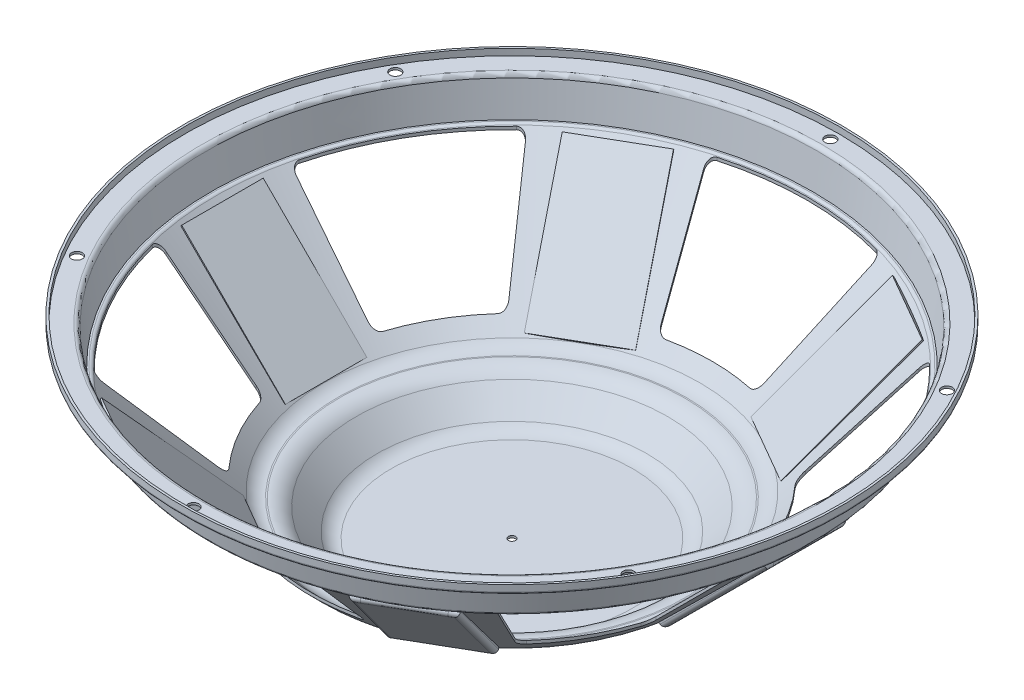
from build123d import *

# Parameters (mm, degrees)
CUT_EXTRUDE_START                  = -5
CUT_EXTRUDE_2_DEPTH                = 113
PATTERN_CIRCULAR_2_COUNT           = 6
SKETCH_9_W                         = 67.51792832
SKETCH_9_H                         = 37.576660832
EXTRUDE_1_DEPTH                    = 4
FILLET_22_R                        = 2
PATTERN_CIRCULAR_33_COUNT          = 6
FILLET_22_OF_PATTERN_CIRCULAR_33_R = 2
SKETCH_13_R                        = 2.5
CUT_EXTRUDE_3_DEPTH                = 234.040768965


with BuildPart() as part:
    # Эскиз1 → Повернуть-Тонкостенный6 (revolve)
    with BuildSketch(Plane.XY, mode=Mode.PRIVATE) as revolve_6_sk:
        with BuildLine():
            Line((1.654421967, 0), (55.740283985, 0))
            ThreePointArc((55.740283985, 0), (59.659260325, 0.799911716), (62.951269649, 3.071675112))
            Line((62.951269649, 3.071675112), (72.561011195, 13.073473474))
            ThreePointArc((72.561011195, 13.073473474), (75.853020518, 15.34523687), (79.771996859, 16.145148586))
            Line((79.771996859, 16.145148586), (80.37014522, 16.145148586))
            ThreePointArc((80.37014522, 16.145148586), (84.196979544, 16.906353261), (87.441213032, 19.074080774))
            Line((87.441213032, 19.074080774), (137.252396214, 68.885263956))
            ThreePointArc((137.252396214, 68.885263956), (137.576819563, 69.102036707), (137.959502995, 69.178157175))
            Line((137.959502995, 69.178157175), (138.680622607, 69.178157175))
            ThreePointArc((138.680622607, 69.178157175), (139.334688835, 69.421719888), (139.670142773, 70.033762436))
            Line((139.670142773, 70.033762436), (141.875146659, 85.144394739))
            ThreePointArc((141.875146659, 85.144394739), (142.210600598, 85.756437287), (142.864666825, 86))
            Line((142.864666825, 86), (151, 86))
            ThreePointArc((151, 86), (151.707106781, 86.292893219), (152, 87))
            Line((152, 87), (152, 90))
            Line((152, 90), (151, 90))
            Line((151, 90), (151, 87))
            Line((151, 87), (142.864666825, 87))
            ThreePointArc((142.864666825, 87), (141.55653437, 86.512874575), (140.885626493, 85.288789479))
            Line((140.885626493, 85.288789479), (138.680622607, 70.178157175))
            Line((138.680622607, 70.178157175), (137.959502995, 70.178157175))
            ThreePointArc((137.959502995, 70.178157175), (137.19413613, 70.02591624), (136.545289433, 69.592370737))
            Line((136.545289433, 69.592370737), (86.734106251, 19.781187555))
            ThreePointArc((86.734106251, 19.781187555), (83.814296111, 17.830232793), (80.37014522, 17.145148586))
            Line((80.37014522, 17.145148586), (79.771996859, 17.145148586))
            ThreePointArc((79.771996859, 17.145148586), (75.461122884, 16.265245699), (71.839912629, 13.766305963))
            Line((71.839912629, 13.766305963), (62.230171082, 3.7645076))
            ThreePointArc((62.230171082, 3.7645076), (59.267362691, 1.719920544), (55.740283985, 1))
            Line((55.740283985, 1), (1.654421967, 1))
            Line((1.654421967, 1), (1.654421967, 0))
        make_face()
    revolve(revolve_6_sk.sketch.rotate(Axis((0, 0, 0), (0, 1, 0)), 90), axis=Axis((0, 0, 0), (0, 1, 0)))

    # Эскиз4 → Вырез-Вытянуть2 (cut)
    with BuildSketch(Plane(origin=(0, 0, 0), x_dir=(1, 0, 0), z_dir=(0, 1, 0)).offset(CUT_EXTRUDE_START)):
        with BuildLine():
            Line((-38.658178622, -127.136601906), (-23.822761983, -92.729045494))
            ThreePointArc((-23.822761983, -92.729045494), (-21.984740883, -90.758563544), (-19.313915643, -90.401053807))
            ThreePointArc((-19.313915643, -90.401053807), (-9.710684671, -91.929758349), (0, -92.441213032))
            ThreePointArc((0, -92.441213032), (9.710684671, -91.929758349), (19.313915643, -90.401053807))
            ThreePointArc((19.313915643, -90.401053807), (21.984740883, -90.758563544), (23.822761983, -92.729045494))
            Line((23.822761983, -92.729045494), (38.658178622, -127.136601906))
            ThreePointArc((38.658178622, -127.136601906), (38.610587871, -129.616995409), (36.711655291, -131.213451444))
            ThreePointArc((36.711655291, -131.213451444), (18.527928909, -134.986782036), (0, -136.252396214))
            ThreePointArc((0, -136.252396214), (-18.527928909, -134.986782036), (-36.711655291, -131.213451444))
            ThreePointArc((-36.711655291, -131.213451444), (-38.610587871, -129.616995409), (-38.658178622, -127.136601906))
        make_face()
    cut_extrude_2 = extrude(amount=CUT_EXTRUDE_2_DEPTH, mode=Mode.SUBTRACT)

    # Круговой массив2: Вырез-Вытянуть2 ×6 about axis
    pattern_circular_2_axis = Axis((0, 0, 0), (0, 1, 0))
    for i in range(1, PATTERN_CIRCULAR_2_COUNT):
        add(cut_extrude_2.rotate(pattern_circular_2_axis, i * 360 / PATTERN_CIRCULAR_2_COUNT), mode=Mode.SUBTRACT)

    # Эскиз9 → Бобышка-Вытянуть1 (add)
    with BuildSketch(Plane(origin=(32.204947847, -32.282452826, 0), x_dir=(-0.7079561148955195, -0.7062564260819453, 7.220019869260539e-15), z_dir=(0.7062564260819453, -0.7079561148955195, 7.237395692760855e-15))):
        with Locations((-109.317087064, 0)):
            Rectangle(SKETCH_9_W, SKETCH_9_H)
    extrude_1 = extrude(amount=EXTRUDE_1_DEPTH)

    # Скругление22
    fillet_22_edges = [part.edges().sort_by_distance(p)[0] for p in [
        (88.521808691, 18.249132558, 0),
        (112.421673801, 42.091617934, -18.788330416),
        (136.321538911, 65.93410331, 0),
        (112.421673801, 42.091617934, 18.788330416),
    ]]
    fillet(fillet_22_edges, radius=FILLET_22_R)

    # Круговой массив33: Бобышка-Вытянуть1 ×6 about axis
    pattern_circular_33_axis = Axis((0, 0, 0), (0, 1, 0))
    for i in range(1, PATTERN_CIRCULAR_33_COUNT):
        add(extrude_1.rotate(pattern_circular_33_axis, i * 360 / PATTERN_CIRCULAR_33_COUNT))

    # Скругление22 of Круговой массив33
    fillet_22_of_pattern_circular_33_edges = [part.edges().sort_by_distance(p)[0] for p in [
        (44.260904345, 18.249132558, -76.662135115),
        (39.939665465, 42.091617934, -106.754190656),
        (68.160769455, 65.93410331, -118.05791578),
        (72.482008336, 42.091617934, -87.965860239),
        (-44.260904345, 18.249132558, -76.662135115),
        (-72.482008336, 42.091617934, -87.965860239),
        (-68.160769455, 65.93410331, -118.05791578),
        (-39.939665465, 42.091617934, -106.754190656),
        (-88.521808691, 18.249132558, 0),
        (-112.421673801, 42.091617934, 18.788330416),
        (-136.321538911, 65.93410331, 0),
        (-112.421673801, 42.091617934, -18.788330416),
        (-44.260904345, 18.249132558, 76.662135115),
        (-39.939665465, 42.091617934, 106.754190656),
        (-68.160769455, 65.93410331, 118.05791578),
        (-72.482008336, 42.091617934, 87.965860239),
        (44.260904345, 18.249132558, 76.662135115),
        (72.482008336, 42.091617934, 87.965860239),
        (68.160769455, 65.93410331, 118.05791578),
        (39.939665465, 42.091617934, 106.754190656),
    ]]
    fillet(fillet_22_of_pattern_circular_33_edges, radius=FILLET_22_OF_PATTERN_CIRCULAR_33_R)

    # Эскиз13 → Вырез-Вытянуть3 (cut, through all)
    with BuildSketch(Plane(origin=(0, 0, 0), x_dir=(1, 0, 0), z_dir=(0, 1, 0))):
        with Locations(Location((0, 146.863332894, 0), (0, 0, 90))):
            Circle(SKETCH_13_R)
        with Locations(Location((127.187377171, 73.431666447, 0), (0, 0, 90))):
            Circle(SKETCH_13_R)
        with Locations(Location((127.187377171, -73.431666447, 0), (0, 0, 90))):
            Circle(SKETCH_13_R)
        with Locations(Location((0, -146.863332894, 0), (0, 0, 90))):
            Circle(SKETCH_13_R)
        with Locations(Location((-127.187377171, -73.431666447, 0), (0, 0, 90))):
            Circle(SKETCH_13_R)
        with Locations(Location((-127.187377171, 73.431666447, 0), (0, 0, 90))):
            Circle(SKETCH_13_R)
    extrude(amount=CUT_EXTRUDE_3_DEPTH, mode=Mode.SUBTRACT)


solid = part.part
